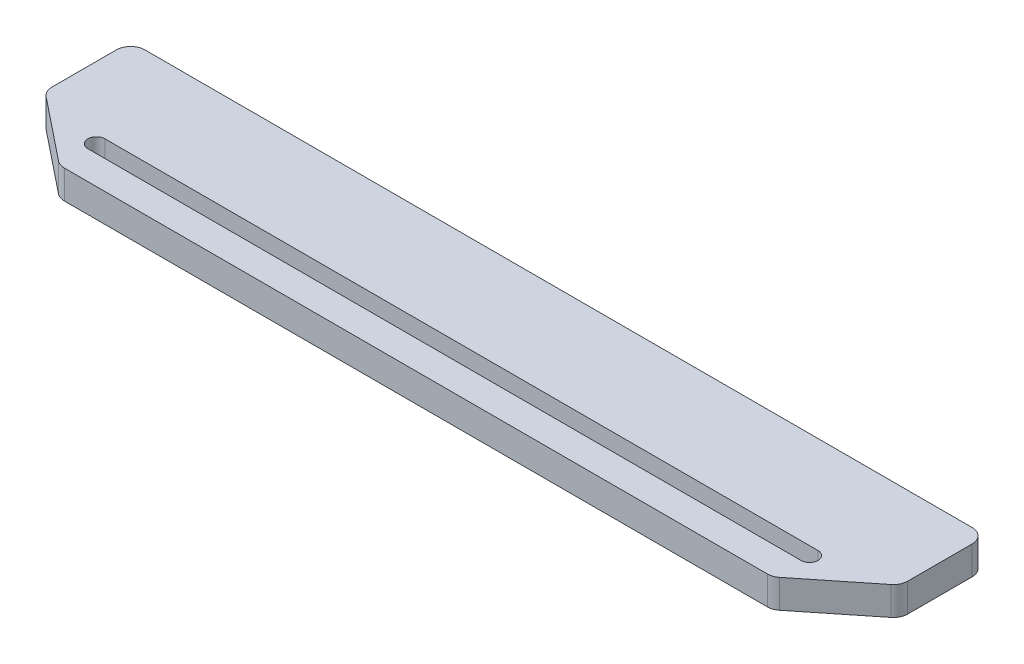
from build123d import *

# Parameters (mm, degrees)
BOSS_EXTRUDE1_DEPTH     = 10
CUT_EXTRUDE4_DEPTH      = 305.302481094
CUT_EXTRUDE4_DEPTH_BACK = 305.302481094


with BuildPart() as part:
    # Sketch1 → Boss-Extrude1 (new body)
    with BuildSketch(Plane(origin=(0, 0, 0), x_dir=(1, 0, 0), z_dir=(0, 1, 0))):
        with BuildLine():
            Line((0, -5), (0, -27.596875763))
            ThreePointArc((0, -27.596875763), (0.493483818, -29.762819415), (1.876524762, -31.50121981))
            Line((1.876524762, -31.50121981), (23.630430059, -48.904344047))
            ThreePointArc((23.630430059, -48.904344047), (25.09887059, -49.718141596), (26.753905297, -50))
            Line((26.753905297, -50), (273.246094703, -50))
            ThreePointArc((273.246094703, -50), (274.90112941, -49.718141596), (276.369569941, -48.904344047))
            Line((276.369569941, -48.904344047), (298.123475238, -31.50121981))
            ThreePointArc((298.123475238, -31.50121981), (299.506516182, -29.762819415), (300, -27.596875763))
            Line((300, -27.596875763), (300, -5))
            ThreePointArc((300, -5), (298.535533906, -1.464466094), (295, 0))
            Line((295, 0), (5, 0))
            ThreePointArc((5, 0), (1.464466094, -1.464466094), (0, -5))
        make_face()
    extrude(amount=BOSS_EXTRUDE1_DEPTH)

    # Sketch2 → Cut-Extrude4 (cut, two sides: drawn at the far end of the back side and taken through both)
    with BuildSketch(Plane(origin=(0, 0, 0), x_dir=(1, 0, 0), z_dir=(0, 1, 0)).offset(-CUT_EXTRUDE4_DEPTH_BACK)):
        with BuildLine():
            Line((25, -34), (275, -34))
            ThreePointArc((275, -34), (278, -37), (275, -40))
            Line((275, -40), (25, -40))
            ThreePointArc((25, -40), (22, -37), (25, -34))
        make_face()
    extrude(amount=CUT_EXTRUDE4_DEPTH + CUT_EXTRUDE4_DEPTH_BACK, mode=Mode.SUBTRACT)


solid = part.part
